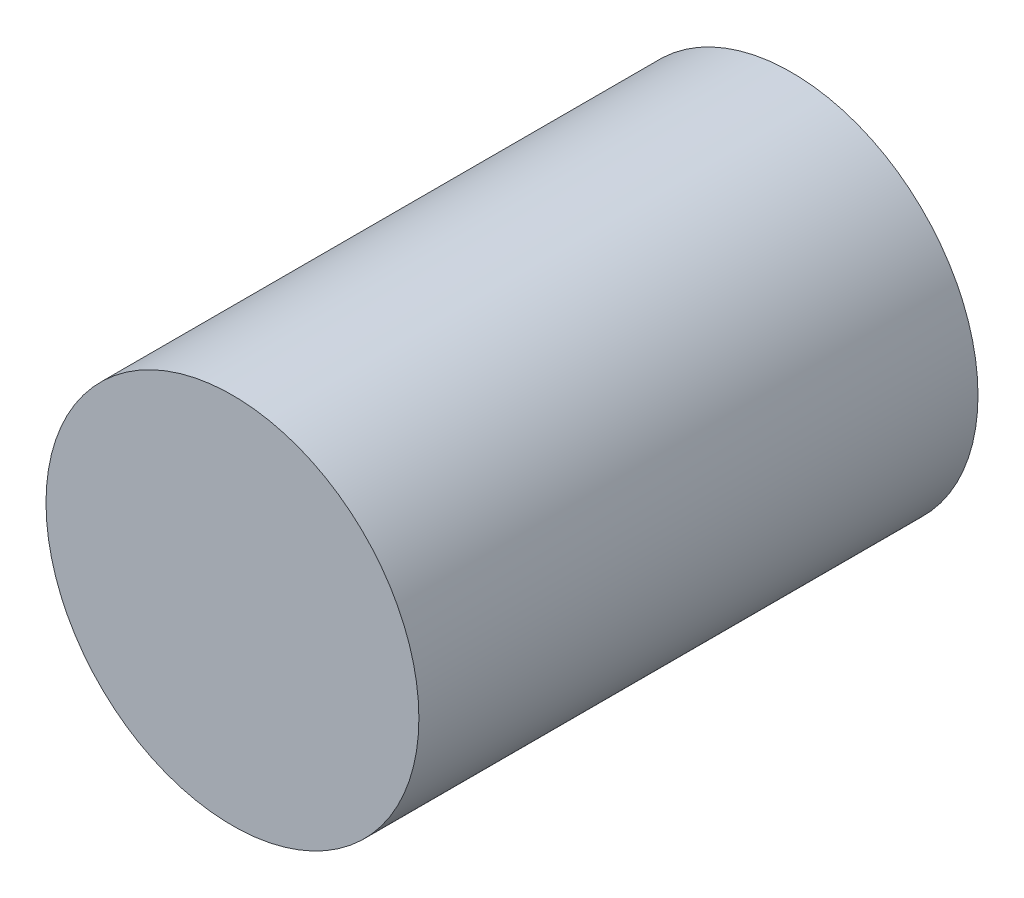
from build123d import *

# Parameters (mm, degrees)
KNIT_START       = -93
KNIT_1_OUTLINE_R = 62.02666435
KNIT_1_DEPTH     = 186


# Read off the part's stored shape, not the designer's step: 曲面-缝合1
with BuildPart() as part:
    # Knit 1 outline → Knit 1 (new body)
    with BuildSketch(Plane.XY.offset(KNIT_START)):
        Circle(KNIT_1_OUTLINE_R)
    extrude(amount=KNIT_1_DEPTH)


solid = part.part
